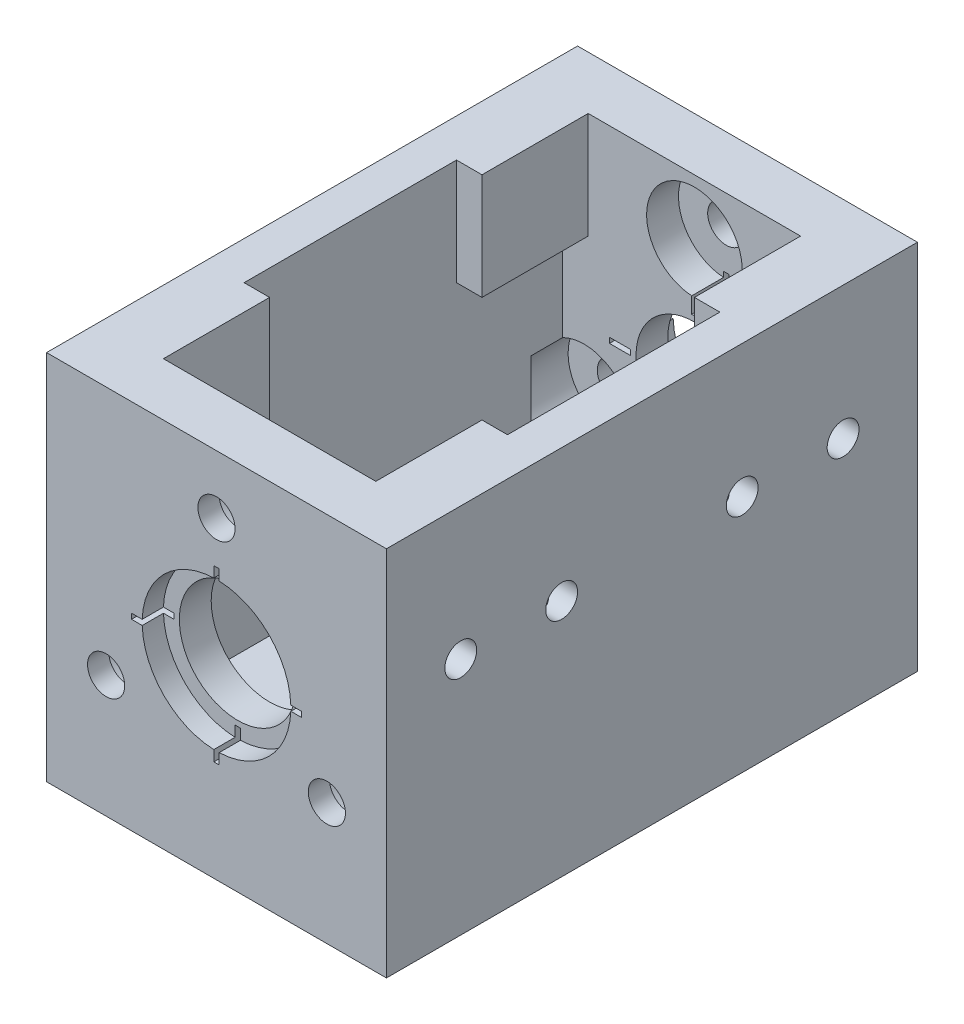
from build123d import *

# Parameters (mm, degrees)
SKETCH1_W               = 32
SKETCH1_H               = 35
BOSS_EXTRUDE1_DEPTH     = 25
SKETCH2_W               = 24.8
SKETCH2_H               = 25
CUT_EXTRUDE1_DEPTH      = 20
SKETCH6_R               = 5.5
CUT_EXTRUDE5_DEPTH      = 80
SKETCH9_W               = 20
SKETCH9_H               = 40
CUT_EXTRUDE7_DEPTH      = 30
SKETCH12_R              = 7
CUT_EXTRUDE9_DEPTH      = 2
SKETCH13_W              = 2
SKETCH13_H              = 0.5
CUT_EXTRUDE10_DEPTH     = 62
CIRPATTERN2_COUNT       = 4
SKETCH17_R              = 1.75
CUT_EXTRUDE14_DEPTH     = 60
CIRPATTERN3_COUNT       = 3
SKETCH19_R              = 4.5
CUT_EXTRUDE15_DEPTH     = 3
MIRROR6_COPY_1_SKETCH_R = 4.5
MIRROR6_COPY_1_DEPTH    = 3
SKETCH22_W              = 2.5
SKETCH22_H              = 5
BOSS_EXTRUDE2_DEPTH     = 45
SKETCH7_W               = 24.8
SKETCH7_H               = 20
CUT_EXTRUDE6_DEPTH      = 30
SKETCH24_R              = 1.5
CUT_EXTRUDE18_DEPTH     = 10
SKETCH25_W              = 25
SKETCH25_H              = 22
CUT_EXTRUDE19_DEPTH     = 3
SKETCH26_R              = 4.5
CUT_EXTRUDE20_DEPTH     = 3
SKETCH28_R              = 1.25
CUT_EXTRUDE22_DEPTH     = 22
FILLET1_R               = 1
SKETCH29_R              = 1.5
CUT_EXTRUDE23_DEPTH     = 10


with BuildPart() as part:
    # Sketch1 → Boss-Extrude1 (new, symmetric)
    with BuildSketch(Plane.XY):
        Rectangle(SKETCH1_W, SKETCH1_H)
    extrude(amount=BOSS_EXTRUDE1_DEPTH, both=True)

    # Sketch2 → Cut-Extrude1 (cut, symmetric)
    with BuildSketch(Plane.XY):
        Rectangle(SKETCH2_W, SKETCH2_H)
    extrude(amount=CUT_EXTRUDE1_DEPTH, both=True, mode=Mode.SUBTRACT)

    # Sketch6 → Cut-Extrude5 (cut)
    with BuildSketch(Plane.XY.offset(25)):
        Circle(SKETCH6_R)
    extrude(amount=-CUT_EXTRUDE5_DEPTH, mode=Mode.SUBTRACT)

    # Sketch9 → Cut-Extrude7 (cut)
    with BuildSketch(Plane(origin=(0, 17.5, 0), x_dir=(1, 0, 0), z_dir=(0, 1, 0))):
        Rectangle(SKETCH9_W, SKETCH9_H)
    extrude(amount=-CUT_EXTRUDE7_DEPTH, mode=Mode.SUBTRACT)

    # Sketch12 → Cut-Extrude9 (cut)
    with BuildSketch(Plane.XY.offset(25)):
        Circle(SKETCH12_R)
    cut_extrude9 = extrude(amount=-CUT_EXTRUDE9_DEPTH, mode=Mode.SUBTRACT)

    # Sketch13 → Cut-Extrude10 (cut)
    with BuildSketch(Plane.XY.offset(25)):
        with Locations((7, 0)):
            Rectangle(SKETCH13_W, SKETCH13_H)
    cut_extrude10 = extrude(amount=-CUT_EXTRUDE10_DEPTH, mode=Mode.SUBTRACT)

    # CirPattern2: Cut-Extrude10 ×4 about axis
    cirpattern2_axis = Axis((0, 0, 23), (0, 0, -1))
    for i in range(1, CIRPATTERN2_COUNT):
        add(cut_extrude10.rotate(cirpattern2_axis, i * 360 / CIRPATTERN2_COUNT), mode=Mode.SUBTRACT)

    # Sketch17 → Cut-Extrude14 (cut)
    with BuildSketch(Plane.XY.offset(25)):
        with Locations((0, 12)):
            Circle(SKETCH17_R)
    cut_extrude14 = extrude(amount=-CUT_EXTRUDE14_DEPTH, mode=Mode.SUBTRACT)

    # CirPattern3: Cut-Extrude14 ×3 about axis
    cirpattern3_axis = Axis((0, 0, 23), (0, 0, -1))
    for i in range(1, CIRPATTERN3_COUNT):
        add(cut_extrude14.rotate(cirpattern3_axis, i * 360 / CIRPATTERN3_COUNT), mode=Mode.SUBTRACT)

    # Sketch19 → Cut-Extrude15 (cut, symmetric)
    with BuildSketch(Plane.XY.offset(-20)):
        with Locations((-10.392304845, -6)):
            Circle(SKETCH19_R)
    cut_extrude15 = extrude(amount=CUT_EXTRUDE15_DEPTH, both=True, mode=Mode.SUBTRACT)

    # Mirror5: Cut-Extrude15 across plane
    add(cut_extrude15.mirror(Plane(origin=(0, 0, 0), x_dir=(0, 0, 1), z_dir=(1, 0, 0))), mode=Mode.SUBTRACT)

    # Mirror6: Cut-Extrude15 across plane
    add(cut_extrude15.mirror(Plane.XY), mode=Mode.SUBTRACT)

    # Mirror6 copy 1 sketch → Mirror6 copy 1 (cut, symmetric)
    with BuildSketch(Plane(origin=(0, 0, 20), x_dir=(-1, 0, 0), z_dir=(0, 0, -1))):
        with Locations((-10.392304845, -6)):
            Circle(MIRROR6_COPY_1_SKETCH_R)
    extrude(amount=MIRROR6_COPY_1_DEPTH, both=True, mode=Mode.SUBTRACT)

    # Sketch22 → Boss-Extrude2 (add)
    with BuildSketch(Plane.XY.offset(-20)):
        with Locations((-11.25, 10)):
            Rectangle(SKETCH22_W, SKETCH22_H)
    boss_extrude2 = extrude(amount=BOSS_EXTRUDE2_DEPTH)

    # Mirror8: Boss-Extrude2 across plane
    add(boss_extrude2.mirror(Plane(origin=(0, 0, 0), x_dir=(0, 0, 1), z_dir=(1, 0, 0))))

    # Sketch7 → Cut-Extrude6 (cut)
    with BuildSketch(Plane(origin=(0, 17.5, 0), x_dir=(1, 0, 0), z_dir=(0, 1, 0))):
        Rectangle(SKETCH7_W, SKETCH7_H)
    extrude(amount=-CUT_EXTRUDE6_DEPTH, mode=Mode.SUBTRACT)

    # Sketch24 → Cut-Extrude18 (cut)
    with BuildSketch(Plane(origin=(16, 0, 0), x_dir=(0, 0, -1), z_dir=(1, 0, 0))):
        with Locations((-18, 5)):
            Circle(SKETCH24_R)
    cut_extrude18 = extrude(amount=-CUT_EXTRUDE18_DEPTH, mode=Mode.SUBTRACT)

    # Mirror9: Cut-Extrude18 across plane
    add(cut_extrude18.mirror(Plane.XY), mode=Mode.SUBTRACT)

    # Sketch25 → Cut-Extrude19 (cut)
    with BuildSketch(Plane(origin=(0, -17.5, 0), x_dir=(-1, 0, 0), z_dir=(0, -1, 0))):
        Rectangle(SKETCH25_W, SKETCH25_H)
    extrude(amount=-CUT_EXTRUDE19_DEPTH, mode=Mode.SUBTRACT)

    # Sketch26 → Cut-Extrude20 (cut)
    with BuildSketch(Plane.XY.offset(-20)):
        with Locations((0, 12)):
            Circle(SKETCH26_R)
    cut_extrude20 = extrude(amount=-CUT_EXTRUDE20_DEPTH, mode=Mode.SUBTRACT)

    # Mirror10: Cut-Extrude20 across plane
    add(cut_extrude20.mirror(Plane.XY), mode=Mode.SUBTRACT)

    # Sketch28 → Cut-Extrude22 (cut)
    with BuildSketch(Plane(origin=(0, -17.5, 0), x_dir=(-1, 0, 0), z_dir=(0, -1, 0))):
        with Locations((-13, 8.5)):
            Circle(SKETCH28_R)
        with Locations((-13, -8.5)):
            Circle(SKETCH28_R)
    extrude(amount=-CUT_EXTRUDE22_DEPTH, mode=Mode.SUBTRACT)

    # Fillet1
    fillet1_edges = [part.edges().sort_by_distance(p)[0] for p in [
        (11.954174967, -14.5, 7.815346803),
        (11.954174967, -14.5, -7.815346803),
    ]]
    fillet(fillet1_edges, radius=FILLET1_R)

    # Sketch29 → Cut-Extrude23 (cut)
    with BuildSketch(Plane(origin=(16, 0, 0), x_dir=(0, 0, -1), z_dir=(1, 0, 0))):
        with Locations((-8.5, 5)):
            Circle(SKETCH29_R)
        with Locations((8.5, 5)):
            Circle(SKETCH29_R)
    extrude(amount=-CUT_EXTRUDE23_DEPTH, mode=Mode.SUBTRACT)

    # Mirror11: Cut-Extrude9 across plane
    add(cut_extrude9.mirror(Plane.XY), mode=Mode.SUBTRACT)


solid = part.part
